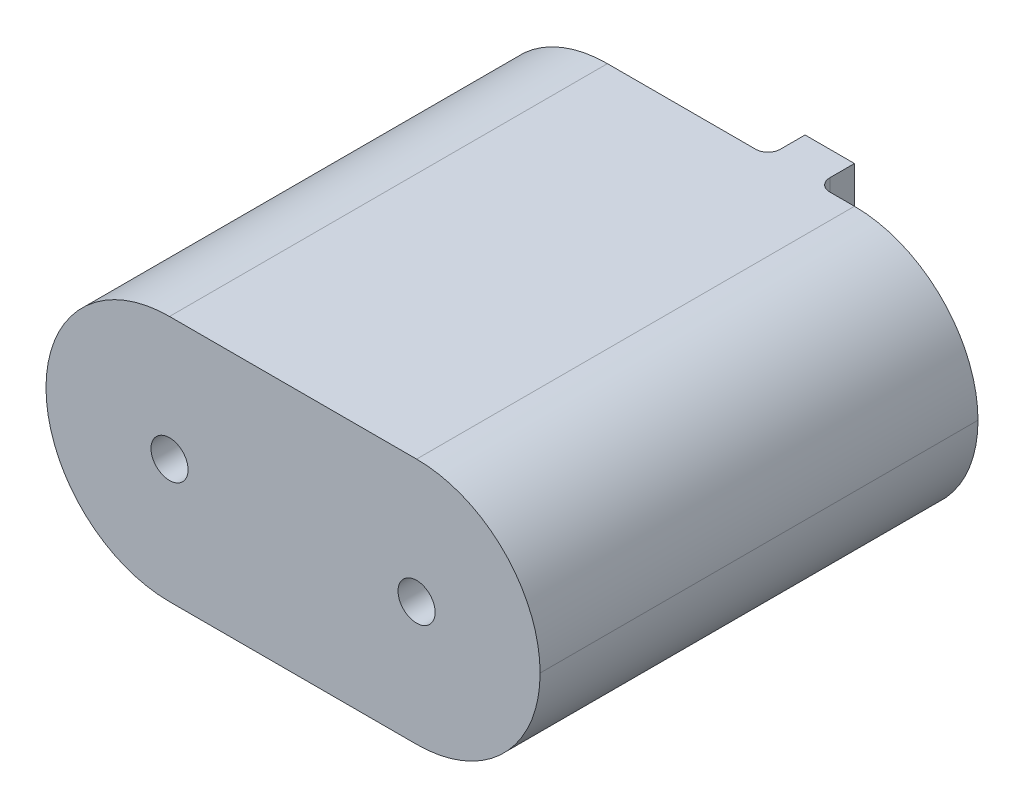
from build123d import *

# Parameters (mm, degrees)
SKETCH_1_W          = 40
SKETCH_1_H          = 35.45
EXTRUDE_1_DEPTH     = 20
FILLET_1_R          = 10
SKETCH_2_R          = 1.5
CUT_EXTRUDE_1_DEPTH = 77
SKETCH_3_W          = 2
SKETCH_3_H          = 10
EXTRUDE_2_DEPTH     = 3
SKETCH_4_W          = 13.504293884
SKETCH_4_H          = 10
CUT_EXTRUDE_2_DEPTH = 3
FILLET_2_R          = 1


with BuildPart() as part:
    # 草图1 → 凸台-拉伸1 (new body)
    with BuildSketch(Plane(origin=(0, 0, 0), x_dir=(1, 0, 0), z_dir=(0, 1, 0))):
        Rectangle(SKETCH_1_W, SKETCH_1_H)
    extrude(amount=EXTRUDE_1_DEPTH)

    # 圆角1
    fillet_1_edges = [part.edges().sort_by_distance(p)[0] for p in [
        (-20, 0, 0),
        (-20, 20, 0),
        (20, 0, 0),
        (20, 20, 0),
    ]]
    fillet(fillet_1_edges, radius=FILLET_1_R - 0.0001)  # a hair under: the kernel refuses the full size

    # 草图2 → 切除-拉伸1 (cut)
    with BuildSketch(Plane(origin=(0, 0, -17.725), x_dir=(-1, 0, 0), z_dir=(0, 0, -1))):
        with Locations((-10, 10)):
            Circle(SKETCH_2_R)
        with Locations((10, 10)):
            Circle(SKETCH_2_R)
    extrude(amount=-CUT_EXTRUDE_1_DEPTH, mode=Mode.SUBTRACT)

    # 草图3 → 凸台-拉伸2 (add)
    with BuildSketch(Plane(origin=(0, 0, -17.725), x_dir=(-1, 0, 0), z_dir=(0, 0, -1))):
        with Locations((-6, 5)):
            Rectangle(SKETCH_3_W, SKETCH_3_H)
        with Locations((-6, 15)):
            Rectangle(SKETCH_3_W, SKETCH_3_H)
        with Locations((-4, 5)):
            Rectangle(SKETCH_3_W, SKETCH_3_H)
        with Locations((-4, 15)):
            Rectangle(SKETCH_3_W, SKETCH_3_H)
    extrude(amount=EXTRUDE_2_DEPTH)

    # 草图4 → 切除-拉伸2 (cut)
    with BuildSketch(Plane(origin=(0, 0, -20.725), x_dir=(-1, 0, 0), z_dir=(0, 0, -1))):
        with Locations((-7, 10)):
            Rectangle(SKETCH_4_W, SKETCH_4_H)
    extrude(amount=-CUT_EXTRUDE_2_DEPTH, mode=Mode.SUBTRACT)

    # 圆角2
    fillet_2_edges = [part.edges().sort_by_distance(p)[0] for p in [
        (7, 17.5, -17.725),
        (3, 17.5, -17.725),
        (7, 2.5, -17.725),
        (3, 2.5, -17.725),
    ]]
    fillet(fillet_2_edges, radius=FILLET_2_R)


solid = part.part
